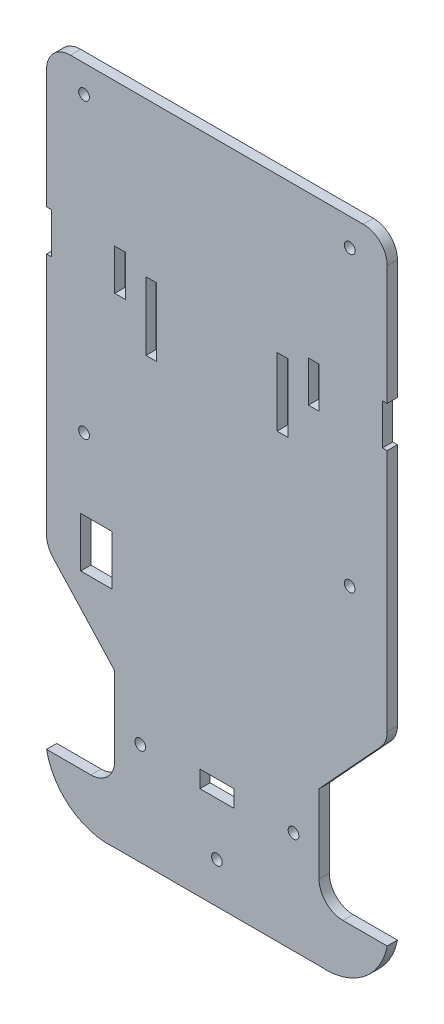
from build123d import *

# Parameters (mm, degrees)
SKETCH1_W           = 9.2
SKETCH1_H           = 14.65
SKETCH1_R           = 1.575
SKETCH1_W_2         = 10
SKETCH1_H_2         = 5
SKETCH1_W_3         = 3.15
SKETCH1_H_3         = 20
SKETCH1_H_4         = 12
BOSS_EXTRUDE2_DEPTH = 3
FILLET1_R           = 7


with BuildPart() as part:
    # Sketch1 → Boss-Extrude2 (new body)
    with BuildSketch(Plane.XY):
        with BuildLine():
            Line((-30, -39), (30, -39))
            ThreePointArc((30, -39), (42.910893348, -35.38119113), (50, -24))
            Line((50, -24), (30, -24))
            Line((30, -24), (30, 6))
            Line((30, 6), (50, 27.730066792))
            Line((50, 27.730066792), (50, 101.943914812))
            Line((50, 101.943914812), (48.6, 101.943914812))
            Line((48.6, 101.943914812), (48.6, 113.943914812))
            Line((48.6, 113.943914812), (50, 113.943914812))
            Line((50, 113.943914812), (50, 156))
            Line((50, 156), (-50, 156))
            Line((-50, 156), (-50, 113.943914812))
            Line((-50, 113.943914812), (-48.6, 113.943914812))
            Line((-48.6, 113.943914812), (-48.6, 101.943914812))
            Line((-48.6, 101.943914812), (-50, 101.943914812))
            Line((-50, 101.943914812), (-50, 27.730066792))
            Line((-50, 27.730066792), (-30, 6))
            Line((-30, 6), (-30, -24))
            Line((-30, -24), (-50, -24))
            ThreePointArc((-50, -24), (-42.910893348, -35.38119113), (-30, -39))
        make_face()
        with Locations((-35.4, 33.675)):
            Rectangle(SKETCH1_W, SKETCH1_H, mode=Mode.SUBTRACT)
        with Locations((0, -27)):
            Circle(SKETCH1_R, mode=Mode.SUBTRACT)
        with Locations((22.5, -9)):
            Circle(SKETCH1_R, mode=Mode.SUBTRACT)
        with Locations((-22.5, -9)):
            Circle(SKETCH1_R, mode=Mode.SUBTRACT)
        with Locations((0, -9)):
            Rectangle(SKETCH1_W_2, SKETCH1_H_2, mode=Mode.SUBTRACT)
        with Locations((39, 148)):
            Circle(SKETCH1_R, mode=Mode.SUBTRACT)
        with Locations((-39, 62)):
            Circle(SKETCH1_R, mode=Mode.SUBTRACT)
        with Locations((-19.246461744, 100.75)):
            Rectangle(SKETCH1_W_3, SKETCH1_H_3, mode=Mode.SUBTRACT)
        with Locations((-28.425, 107.943914812)):
            Rectangle(SKETCH1_W_3, SKETCH1_H_4, mode=Mode.SUBTRACT)
        with Locations((-39, 148)):
            Circle(SKETCH1_R, mode=Mode.SUBTRACT)
        with Locations((19.246461744, 100.75)):
            Rectangle(SKETCH1_W_3, SKETCH1_H_3, mode=Mode.SUBTRACT)
        with Locations((39, 62)):
            Circle(SKETCH1_R, mode=Mode.SUBTRACT)
        with Locations((28.425, 107.943914812)):
            Rectangle(SKETCH1_W_3, SKETCH1_H_4, mode=Mode.SUBTRACT)
    extrude(amount=BOSS_EXTRUDE2_DEPTH)

    # Fillet1
    # the kernel refuses this fillet: 7 mm, written as the material it adds along each edge
    with BuildSketch(Plane(origin=(-30, -39, 0), x_dir=(1, 0, 0), z_dir=(0, 0, 1))) as fillet1_piece_1:
        with BuildLine():
            CenterArc((0.312366932, -7), FILLET1_R, 90, 4.731570596)
            ThreePointArc((-0.265046647, -0.023855394), (-0.132480496, -0.012403535), (0, 0))
            Line((0, 0), (0.312366932, 0))
        make_face()
    extrude(amount=3)
    with BuildSketch(Plane(origin=(-30, -24, 0), x_dir=(0, 1, 0), z_dir=(0, 0, 1)), Plane(origin=(30, -24, 0), x_dir=(1, 0, 0), z_dir=(0, 0, 1))) as fillet1_piece_2:
        with BuildLine():
            CenterArc((FILLET1_R, FILLET1_R), FILLET1_R, 180, 90)
            Line((0, FILLET1_R), (0, 0))
            Line((0, 0), (FILLET1_R, 0))
        make_face()
    extrude(amount=3)
    with BuildSketch(Plane(origin=(30, -39, 0), x_dir=(-1, 0, 0), z_dir=(0, 0, 1))) as fillet1_piece_3:
        with BuildLine():
            CenterArc((0.312366932, 7), FILLET1_R, 265.268429404, 4.731570596)
            ThreePointArc((-0.265046647, 0.023855394), (-0.132480496, 0.012403535), (0, 0))
            Line((0, 0), (0.312366932, 0))
        make_face()
    extrude(amount=3)
    # the kernel refuses this fillet: 7 mm, written as the material it takes off along each edge
    with BuildSketch(Plane(origin=(-50, 27.730066792, -6.827532689), x_dir=(0, 1, 0), z_dir=(0, 0, 1)), Plane(origin=(50, 27.730066792, -6.827532689), x_dir=(-0.6772094339211744, -0.7357903115753581, 0), z_dir=(0, 0, 1))) as fillet1_2_piece_1:
        with BuildLine():
            CenterArc((FILLET1_R * 0.390144725089, -FILLET1_R), FILLET1_R, 90, 42.625961352)
            Line((-FILLET1_R * 0.287064708832, -FILLET1_R * 0.264209688425), (0, 0))
            Line((0, 0), (FILLET1_R * 0.390144725089, 0))
        make_face()
    extrude(amount=16.655065378, mode=Mode.SUBTRACT)
    with BuildSketch(Plane(origin=(-50, 156, -17.5), x_dir=(1, 0, 0), z_dir=(0, 0, 1)), Plane(origin=(50, 156, -17.5), x_dir=(0, -1, 0), z_dir=(0, 0, 1))) as fillet1_2_piece_2:
        with BuildLine():
            CenterArc((FILLET1_R, -FILLET1_R), FILLET1_R, 90, 90)
            Line((0, -FILLET1_R), (0, 0))
            Line((0, 0), (FILLET1_R, 0))
        make_face()
    extrude(amount=38, mode=Mode.SUBTRACT)


solid = part.part
